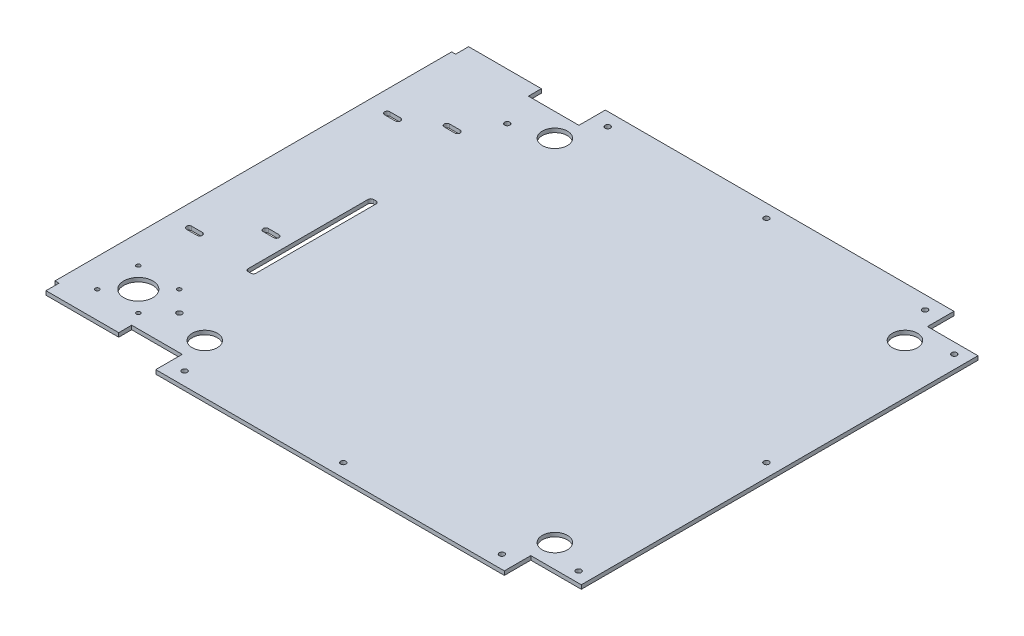
from build123d import *

# Parameters (mm, degrees)
SKETCH1_4_R         = 2
SKETCH1_4_R_2       = 9.5
SKETCH1_4_R_3       = 1.5
SKETCH1_4_R_4       = 11
BOSS_EXTRUDE3_DEPTH = 3


with BuildPart() as part:
    # Sketch1<4> → Boss-Extrude3 (new body)
    with BuildSketch(Plane(origin=(0, 0, 0), x_dir=(1, 0, 0), z_dir=(0, 1, 0))):
        Polygon((170, -150), (170, 150), (131.8, 150), (131.8, 170), (-131.8, 170), (-131.8, 150), (-170, 150), (-170, 159.8), (-225, 159.8), (-225, 150), (-228, 150), (-228, -150), (-225, -150), (-225, -159.8), (-170, -159.8), (-170, -150), (-131.8, -150), (-131.8, -170), (131.8, -170), (131.8, -150), align=None)
        with Locations((160, -142)):
            Circle(SKETCH1_4_R, mode=Mode.SUBTRACT)
        with Locations((160, 0)):
            Circle(SKETCH1_4_R, mode=Mode.SUBTRACT)
        with Locations((160, 142)):
            Circle(SKETCH1_4_R, mode=Mode.SUBTRACT)
        with Locations((132.375, -132.375)):
            Circle(SKETCH1_4_R_2, mode=Mode.SUBTRACT)
        with Locations((-160, -124)):
            Circle(SKETCH1_4_R, mode=Mode.SUBTRACT)
        with BuildLine():
            Line((-159, -70.911348687), (-161, -70.911348687))
            ThreePointArc((-161, -70.911348687), (-162.414213562, -70.325562249), (-163, -68.911348687))
            Line((-163, -68.911348687), (-163, 21.794447152))
            ThreePointArc((-163, 21.794447152), (-162.414213562, 23.208660714), (-161, 23.794447152))
            Line((-161, 23.794447152), (-159, 23.794447152))
            ThreePointArc((-159, 23.794447152), (-157.585786438, 23.208660714), (-157, 21.794447152))
            Line((-157, 21.794447152), (-157, -68.911348687))
            ThreePointArc((-157, -68.911348687), (-157.585786438, -70.325562249), (-159, -70.911348687))
        make_face(mode=Mode.SUBTRACT)
        with Locations((-160, 124)):
            Circle(SKETCH1_4_R, mode=Mode.SUBTRACT)
        with Locations((132.375, 132.375)):
            Circle(SKETCH1_4_R_2, mode=Mode.SUBTRACT)
        with Locations((0, -160)):
            Circle(SKETCH1_4_R, mode=Mode.SUBTRACT)
        with Locations((120, -160)):
            Circle(SKETCH1_4_R, mode=Mode.SUBTRACT)
        with Locations((-120, -160)):
            Circle(SKETCH1_4_R, mode=Mode.SUBTRACT)
        with Locations((120, 160)):
            Circle(SKETCH1_4_R, mode=Mode.SUBTRACT)
        with Locations((0, 160)):
            Circle(SKETCH1_4_R, mode=Mode.SUBTRACT)
        with Locations((-120, 160)):
            Circle(SKETCH1_4_R, mode=Mode.SUBTRACT)
        with Locations((-132.375, 132.375)):
            Circle(SKETCH1_4_R_2, mode=Mode.SUBTRACT)
        with Locations((-132.375, -132.375)):
            Circle(SKETCH1_4_R_2, mode=Mode.SUBTRACT)
        with Locations((-206.5, -108.5)):
            Circle(SKETCH1_4_R_3, mode=Mode.SUBTRACT)
        with Locations((-175.5, -108.5)):
            Circle(SKETCH1_4_R_3, mode=Mode.SUBTRACT)
        with Locations((-206.5, -139.5)):
            Circle(SKETCH1_4_R_3, mode=Mode.SUBTRACT)
        with Locations((-175.5, -139.5)):
            Circle(SKETCH1_4_R_3, mode=Mode.SUBTRACT)
        with Locations((-191, -124)):
            Circle(SKETCH1_4_R_4, mode=Mode.SUBTRACT)
        with BuildLine():
            ThreePointArc((-212.1, -66.5), (-214.1, -64.5), (-212.1, -62.5))
            Line((-212.1, -62.5), (-204.1, -62.5))
            ThreePointArc((-204.1, -62.5), (-202.1, -64.5), (-204.1, -66.5))
            Line((-204.1, -66.5), (-212.1, -66.5))
        make_face(mode=Mode.SUBTRACT)
        with BuildLine():
            ThreePointArc((-181.6, -39), (-183.6, -37), (-181.6, -35))
            Line((-181.6, -35), (-173.6, -35))
            ThreePointArc((-173.6, -35), (-171.6, -37), (-173.6, -39))
            Line((-173.6, -39), (-181.6, -39))
        make_face(mode=Mode.SUBTRACT)
        with BuildLine():
            ThreePointArc((-212.1, 83.4), (-214.1, 85.4), (-212.1, 87.4))
            Line((-212.1, 87.4), (-204.1, 87.4))
            ThreePointArc((-204.1, 87.4), (-202.1, 85.4), (-204.1, 83.4))
            Line((-204.1, 83.4), (-212.1, 83.4))
        make_face(mode=Mode.SUBTRACT)
        with BuildLine():
            ThreePointArc((-181.6, 98), (-183.6, 100), (-181.6, 102))
            Line((-181.6, 102), (-173.6, 102))
            ThreePointArc((-173.6, 102), (-171.6, 100), (-173.6, 98))
            Line((-173.6, 98), (-181.6, 98))
        make_face(mode=Mode.SUBTRACT)
    extrude(amount=BOSS_EXTRUDE3_DEPTH)


solid = part.part
